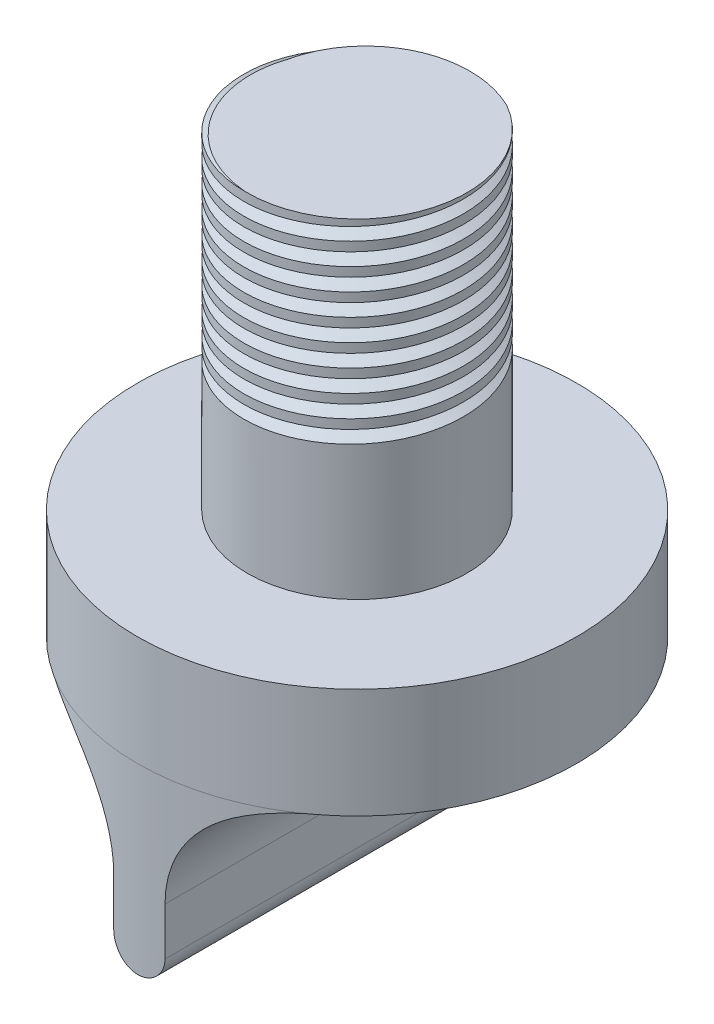
from build123d import *

# Parameters (mm, degrees)
SKETCH2_R           = 15
BOSS_EXTRUDE1_DEPTH = 7.5
SKETCH3_R           = 7.5
BOSS_EXTRUDE2_DEPTH = 22.5
BOSS_EXTRUDE3_DEPTH = 12.5
FILLET1_R           = 7.5
FILLET2_START       = -16
FILLET2_DEPTH       = 32
CUT_SWEEP5_PITCH    = 1.5


with BuildPart() as part:
    # Sketch2 → Boss-Extrude1 (new body)
    with BuildSketch(Plane(origin=(0, 0, 0), x_dir=(1, 0, 0), z_dir=(0, 1, 0))):
        with Locations(Location((0, 0, 0), (0, 0, 270))):
            Circle(SKETCH2_R)
    extrude(amount=BOSS_EXTRUDE1_DEPTH)

    # Sketch3 → Boss-Extrude2 (add)
    with BuildSketch(Plane(origin=(0, 7.5, 0), x_dir=(1, 0, 0), z_dir=(0, 1, 0))):
        with Locations(Location((0, 0, 0), (0, 0, 90))):
            Circle(SKETCH3_R)
    extrude(amount=BOSS_EXTRUDE2_DEPTH)

    # Sketch16 → Boss-Extrude3 (add)
    with BuildSketch(Plane.XZ):
        with BuildLine():
            Line((-1.75, 14.863329244), (-1.75, -14.863329244))
            ThreePointArc((-1.75, -14.863329244), (0, -14.965996667), (1.75, -14.863329244))
            Line((1.75, -14.863329244), (1.75, 14.863329244))
            ThreePointArc((1.75, 14.863329244), (0, 14.965996667), (-1.75, 14.863329244))
        make_face()
    extrude(amount=BOSS_EXTRUDE3_DEPTH)

    # Fillet1
    fillet1_edges = [part.edges().sort_by_distance(p)[0] for p in [
        (1.75, 0, 0),
        (-1.75, 0, 0),
    ]]
    fillet(fillet1_edges, radius=FILLET1_R)

    # Fillet2: read off the stored shape, not the designer's step
    # Fillet2 outline → Fillet2 (cut)
    with BuildSketch(Plane.XY.offset(FILLET2_START)):
        with BuildLine():
            Line((1.75, -12.5), (1.75, -10.75))
            ThreePointArc((1.75, -10.75), (1.237436867, -11.987436867), (0, -12.5))
            Line((0, -12.5), (1.75, -12.5))
        make_face()
        with BuildLine():
            Line((-1.75, -12.5), (0, -12.5))
            ThreePointArc((0, -12.5), (-1.237436867, -11.987436867), (-1.75, -10.75))
            Line((-1.75, -10.75), (-1.75, -12.5))
        make_face()
    extrude(amount=FILLET2_DEPTH, mode=Mode.SUBTRACT)

    # Cut-Sweep5: arcs per turn and ends read off the stored shape
    # Cut-Sweep5: the profile of Sketch13 profile screwed along a right-hand helix through 10 turns, 8 arcs to a turn; built about Z, then put on its axis
    cut_sweep5_z = Axis((0, 0, 0), (0, 0, 1))
    cut_sweep5_corners = [(7.5003, 0, -0.000173205), (6.744841115, 0, 0.435991185), (7.5003, 0, 0.872155576)]
    with BuildLine(mode=Mode.PRIVATE) as cut_sweep5_profile:
        Line(cut_sweep5_corners[0], cut_sweep5_corners[1])
        Line(cut_sweep5_corners[1], cut_sweep5_corners[2])
        Line(cut_sweep5_corners[2], cut_sweep5_corners[0])
    cut_sweep5_cap = Face(cut_sweep5_profile.wire())
    cut_sweep5_turn_angles = [0, 22.5, 45, 67.5, 90, 112.5, 135, 157.5, 180, 202.5, 225, 247.5, 270, 292.5, 315, 337.5, 360]
    cut_sweep5_turn_weights = [1, 0.9238795325112867, 1, 0.9238795325112867, 1, 0.9238795325112867, 1, 0.9238795325112867, 1, 0.9238795325112867, 1, 0.9238795325112867, 1, 0.9238795325112867, 1, 0.9238795325112867, 1]
    cut_sweep5_turn_rails = [Edge.make_bspline([Vector(p[0], p[1], 0).rotate(cut_sweep5_z, cut_sweep5_turn_angles[k]) / cut_sweep5_turn_weights[k] + Vector(0, 0, p[2] + CUT_SWEEP5_PITCH * cut_sweep5_turn_angles[k] / 360) for k in range(17)], [0, 0, 0, 1, 1, 2, 2, 3, 3, 4, 4, 5, 5, 6, 6, 7, 7, 8, 8, 8], 2, cut_sweep5_turn_weights) for p in cut_sweep5_corners]
    cut_sweep5_turn_sides = [Face.make_surface_from_curves(cut_sweep5_turn_rails[p[0]], cut_sweep5_turn_rails[p[1]]) for p in [(0, 1), (1, 2), (2, 0)]]
    cut_sweep5 = Plane(origin=(0, 32, 0), x_dir=(-1, 0, 0), z_dir=(0, -1, 0)) * Solid(Shell([*[p.moved(Location((0, 0, CUT_SWEEP5_PITCH * i))) for i in range(10) for p in cut_sweep5_turn_sides], cut_sweep5_cap, cut_sweep5_cap.rotate(cut_sweep5_z, 3600).moved(Location((0, 0, CUT_SWEEP5_PITCH * 3600 / 360)))]))
    add(cut_sweep5, mode=Mode.SUBTRACT)


solid = part.part
